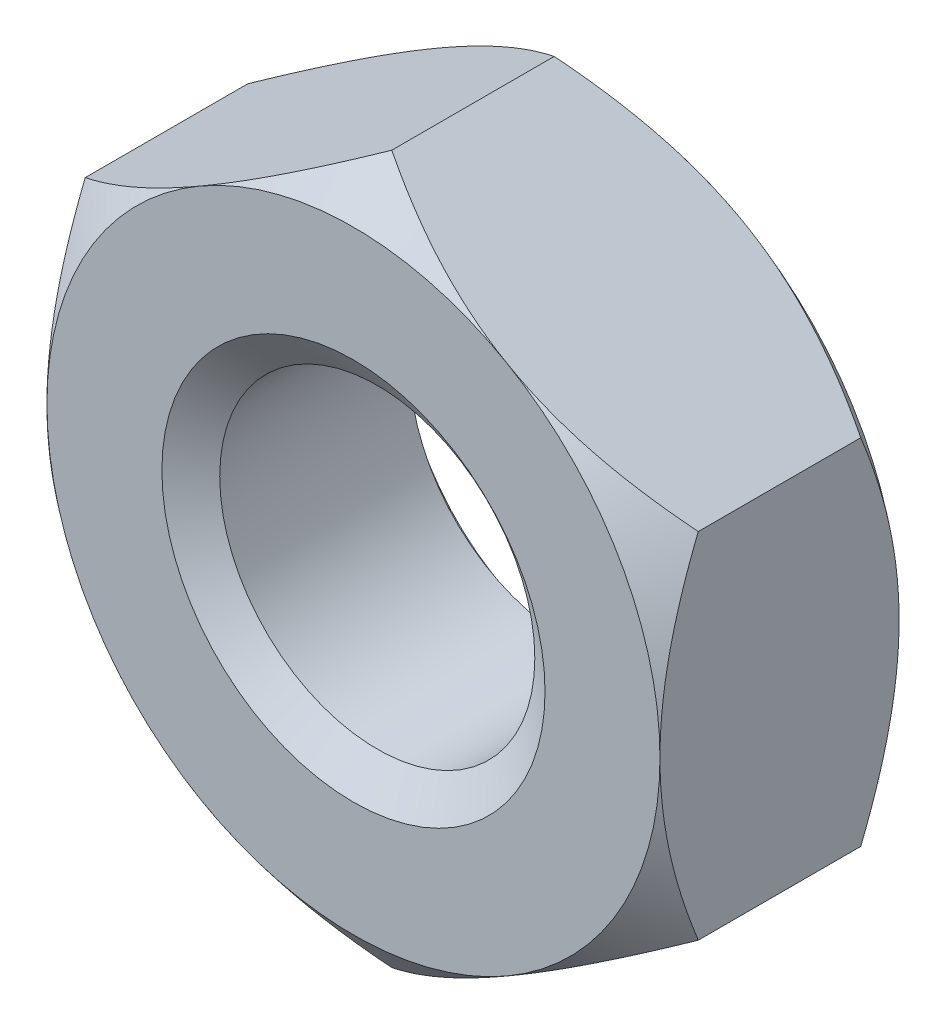
from build123d import *

# Parameters (mm, degrees)
THREADSCHEMATIC_START     = -4.953
THREADSCHEMATIC_OUTLINE_R = 3.2639
THREADSCHEMATIC_DEPTH     = 4.953


# Read off the part's stored shape, not the designer's step: ThreadSchematic
with BuildPart() as part:
    # ThreadSchematic outline → ThreadSchematic (new body)
    with BuildSketch(Plane.XY.offset(THREADSCHEMATIC_START)):
        Polygon((6.35, 3.666174209), (0, 7.332348419), (-6.35, 3.666174209), (-6.35, -3.666174209), (0, -7.332348419), (6.35, -3.666174209), align=None)
        Circle(THREADSCHEMATIC_OUTLINE_R, mode=Mode.SUBTRACT)
    extrude(amount=THREADSCHEMATIC_DEPTH)

    # Sketch3 → Double-Chamfer (revolve, cut)
    with BuildSketch(Plane(origin=(0, 0, 0), x_dir=(0, 0, -1), z_dir=(1, 0, 0))):
        Polygon((4.953, 6.35), (4.15925, 7.332348419), (4.15925, 20.032348419), (17.653, 20.032348419), (17.653, 6.35), align=None)
        Polygon((0.79375, 20.032348419), (-12.7, 20.032348419), (-12.7, 6.35), (0, 6.35), (0.79375, 7.332348419), align=None)
    revolve(axis=Axis((0, 0, 0), (0, 0, -1)), mode=Mode.SUBTRACT)

    # EndChamferSke → EndChamfer (revolve, cut)
    with BuildSketch(Plane(origin=(0, 0, 0), x_dir=(0, 0, -1), z_dir=(1, 0, 0)), mode=Mode.PRIVATE) as endchamfer_sk:
        Polygon((4.9276, 3.96875), (4.384704588, 3.193415), (4.9784, 3.193415), (4.9784, 3.96875), align=None)
        Polygon((-0.0508, 3.96875), (0, 3.96875), (0.542895412, 3.193415), (-0.0508, 3.193415), align=None)
    revolve(endchamfer_sk.sketch.rotate(Axis((0, 0, -25.037505729), (0, 0, -1)), 90), axis=Axis((0, 0, -25.037505729), (0, 0, -1)), mode=Mode.SUBTRACT)


solid = part.part
